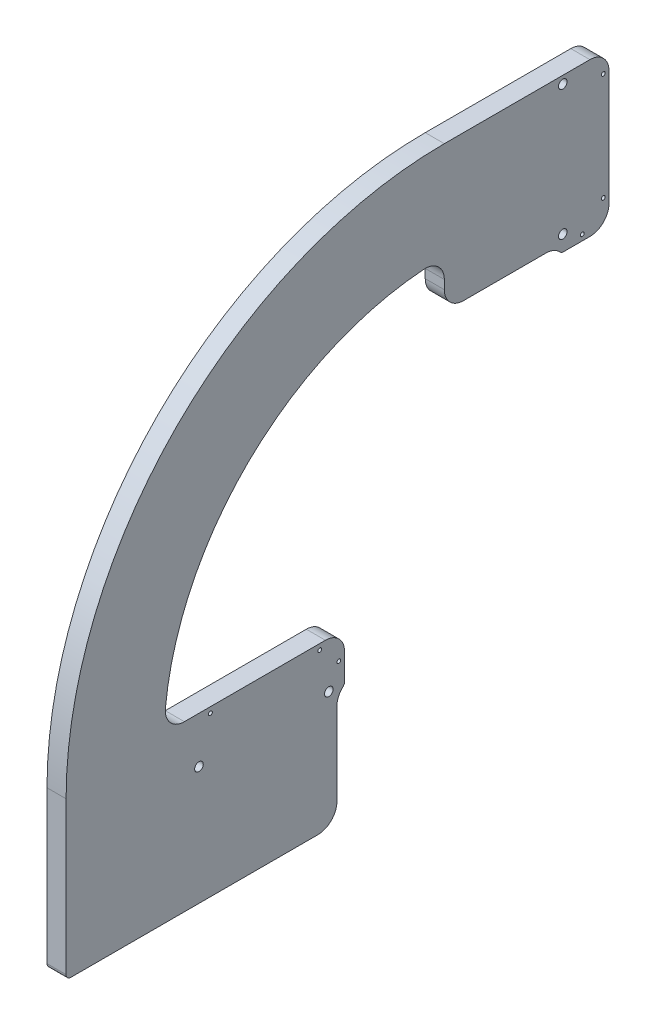
from build123d import *

# Parameters (mm, degrees)
BOSS_EXTRUDE1_DEPTH   = 10
M4_CLEARANCE_HOLE1_D  = 4.5
F_2_0MM_DOWEL_HOLE1_D = 2
FILLET1_R             = 10
FILLET2_R             = 2.5


with BuildPart() as part:
    # Sketch1 → Boss-Extrude1 (new body)
    with BuildSketch(Plane(origin=(0, 0, 0), x_dir=(0, 0, -1), z_dir=(1, 0, 0))):
        with BuildLine():
            Line((-27.833971588, 109.065439697), (-27.833971588, 84.065439697))
            Line((-27.833971588, 84.065439697), (33.366028214, 84.065439697))
            Line((33.366028214, 84.065439697), (33.366028214, 80.065439697))
            Line((33.366028214, 80.065439697), (58.366028214, 80.065439697))
            Line((58.366028214, 80.065439697), (58.366028214, 160.265439697))
            Line((58.366028214, 160.265439697), (54.366028214, 160.265439697))
            Line((54.366028214, 160.265439697), (-27.833971588, 160.265439697))
            ThreePointArc((-27.833971588, 160.265439697), (-167.840009366, 102.273040036), (-225.832409027, -37.732997742))
            Line((-225.832409027, -37.732997742), (-225.832409027, -119.932997544))
            Line((-225.832409027, -119.932997544), (-84.083971786, -119.932997544))
            Line((-84.083971786, -119.932997544), (-84.083971786, -58.732997742))
            Line((-84.083971786, -58.732997742), (-80.083971786, -58.732997742))
            Line((-80.083971786, -58.732997742), (-80.083971786, -33.732997742))
            Line((-80.083971786, -33.732997742), (-174.577902415, -33.732997742))
            ThreePointArc((-174.577902415, -33.732997742), (-130.212161367, 67.473881749), (-27.833971588, 109.065439697))
        make_face()
    extrude(amount=BOSS_EXTRUDE1_DEPTH)

    # M4 Clearance Hole1 (through all)
    with Locations(Plane(origin=(10, 0, 0), x_dir=(0, 0, -1), z_dir=(1, 0, 0))):
        with Locations((-156.283971786, -57.932997742), (-88.283971786, -57.932997742), (34.166028214, 156.265439697), (34.166028214, 88.265439697)):
            Hole(M4_CLEARANCE_HOLE1_D / 2)

    # Ø2.0mm Dowel Hole1 (through all)
    with Locations(Plane(origin=(10, 0, 0), x_dir=(0, 0, -1), z_dir=(1, 0, 0))):
        with Locations((44.366028214, 83.065439697), (55.366028214, 94.065439697), (55.366028214, 150.265439697), (-150.283971786, -36.732997742), (-93.083971786, -36.732997742), (-83.083971786, -46.732997742)):
            Hole(F_2_0MM_DOWEL_HOLE1_D / 2)

    # Fillet1
    # the kernel refuses this fillet: 10 mm, written as the material it adds along each edge
    with BuildSketch(Plane(origin=(0, -58.732997742, 84.083971786), x_dir=(0, 0, -1), z_dir=(1, 0, 0))) as fillet1_piece_1:
        with BuildLine():
            CenterArc((10, -8), FILLET1_R, 126.869897646, 53.130102354)
            Line((0, -8), (0, 0))
            Line((0, 0), (4, 0))
        make_face()
    extrude(amount=10)
    with BuildSketch(Plane(origin=(0, 84.065439697, -33.366028214), x_dir=(0, 0, 1), z_dir=(1, 0, 0))) as fillet1_piece_2:
        with BuildLine():
            CenterArc((8, 10), FILLET1_R, 216.869897646, 53.130102354)
            Line((0, 4), (0, 0))
            Line((0, 0), (8, 0))
        make_face()
    extrude(amount=10)
    with BuildSketch(Plane(origin=(0, -33.732997742, 174.577902415), x_dir=(0, 0.9978956594350473, -0.06484021036896881), z_dir=(1, 0, 0))) as fillet1_piece_3:
        with BuildLine():
            CenterArc((10.670397133, -9.992919204), FILLET1_R, 87.843724259, 95.873954258)
            Line((0.691440539, -10.641321308), (0, 0))
            ThreePointArc((0, 0), (5.523324707, 0.103944977), (11.046649415, 0))
        make_face()
    extrude(amount=10)
    with BuildSketch(Plane(origin=(0, 109.065439697, 27.833971588), x_dir=(0, -1, 0), z_dir=(1, 0, 0))) as fillet1_piece_4:
        with BuildLine():
            CenterArc((10.365990837, -10), FILLET1_R, 90, 94.192074979)
            ThreePointArc((0.392744859, -10.731002502), (0.098219073, -5.369093574), (0, 0))
            Line((0, 0), (10.365990837, 0))
        make_face()
    extrude(amount=10)
    # the kernel refuses this fillet: 10 mm, written as the material it takes off along each edge
    with BuildSketch(Plane(origin=(-25, -119.932997544, 84.083971786), x_dir=(0, 1, 0), z_dir=(1, 0, 0)), Plane(origin=(-25, -33.732997742, 80.083971786), x_dir=(0, 0, 1), z_dir=(1, 0, 0))) as fillet1_2_piece_1:
        with BuildLine():
            CenterArc((FILLET1_R, FILLET1_R), FILLET1_R, 180, 90)
            Line((0, FILLET1_R), (0, 0))
            Line((0, 0), (FILLET1_R, 0))
        make_face()
    extrude(amount=60, mode=Mode.SUBTRACT)
    with BuildSketch(Plane(origin=(-25, 84.065439697, 27.833971588), x_dir=(0, 1, 0), z_dir=(1, 0, 0)), Plane(origin=(-25, 160.265439697, -58.366028214), x_dir=(0, -1, 0), z_dir=(1, 0, 0)), Plane(origin=(-25, 80.065439697, -58.366028214), x_dir=(0, 0, 1), z_dir=(1, 0, 0))) as fillet1_2_piece_2:
        with BuildLine():
            CenterArc((FILLET1_R, -FILLET1_R), FILLET1_R, 90, 90)
            Line((0, -FILLET1_R), (0, 0))
            Line((0, 0), (FILLET1_R, 0))
        make_face()
    extrude(amount=60, mode=Mode.SUBTRACT)

    # Fillet2
    fillet2_edges = [part.edges().sort_by_distance(p)[0] for p in [
        (5, 80.065439697, -33.366028214),
        (5, -58.732997742, 80.083971786),
        (5, -119.932997544, 225.832409027),
    ]]
    fillet(fillet2_edges, radius=FILLET2_R)


solid = part.part
